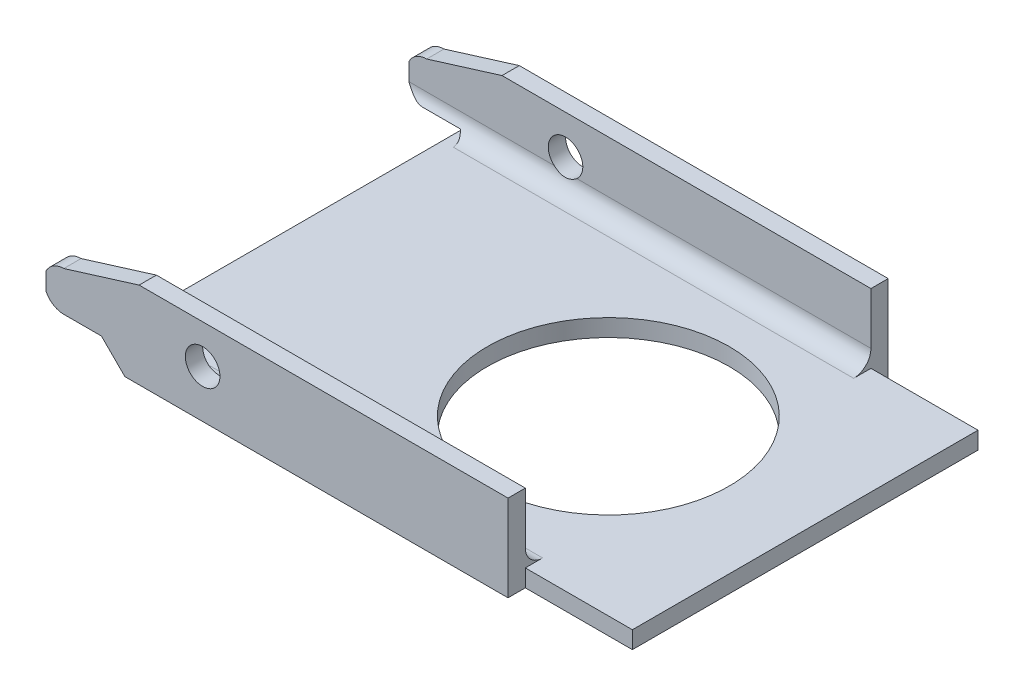
from build123d import *

# Parameters (mm, degrees)
SKETCH1_W               = 76.2
SKETCH1_H               = 50.8
BOSS_EXTRUDE1_DEPTH     = 2.54
BOSS_EXTRUDE3_DEPTH     = 2.54
FILLET1_START           = -37.396373698
FILLET1_DEPTH           = 59.758551136
FILLET1_START_2         = -45.547043779
FILLET1_2_DEPTH         = 8.279361144
FILLET1_START_3         = 22
FILLET1_3_DEPTH         = 3.4
FILLET2_START           = -42.930825639
FILLET2_DEPTH           = 65.293003077
FILLET2_START_2         = -37.396373698
FILLET2_2_DEPTH         = 59.758551136
FILLET2_START_3         = -45.547043779
FILLET2_3_DEPTH         = 2.61621814
FILLET2_START_4         = -25.4
FILLET2_4_DEPTH         = 3.4
CUT_EXTRUDE1_DEPTH      = 74.201076537
CUT_EXTRUDE1_DEPTH_BACK = 74.201076537
SKETCH3_R               = 2.54
CUT_EXTRUDE2_DEPTH      = 55.391197925
CUT_EXTRUDE2_DEPTH_BACK = 55.391197925
SKETCH4_R               = 17.770620532


with BuildPart() as part:
    # Sketch1 → Boss-Extrude1 (new body)
    with BuildSketch(Plane(origin=(0, 0, 0), x_dir=(1, 0, 0), z_dir=(0, 1, 0))):
        Rectangle(SKETCH1_W, SKETCH1_H)
    extrude(amount=BOSS_EXTRUDE1_DEPTH)

    # Sketch2 → Boss-Extrude3 (add)
    with BuildSketch(Plane.XY.offset(25.4)):
        Polygon((22.362177438, 0), (22.362177438, 2.54), (-36.496143753, 2.54), (-33.956143753, 0), align=None)
        with BuildLine():
            Line((22.362177438, 12.7), (-31.861921757, 12.7))
            Line((-31.861921757, 12.7), (-42.930825639, 9.27384145))
            ThreePointArc((-42.930825639, 9.27384145), (-44.471302904, 8.833865445), (-45.547043679, 7.646670905))
            Line((-45.547043679, 7.646670905), (-45.547043679, 5.06740049))
            ThreePointArc((-45.547043679, 5.06740049), (-44.471302904, 3.88020595), (-42.930825639, 3.440229945))
            Line((-42.930825639, 3.440229945), (-37.396373698, 3.440229945))
            Line((-37.396373698, 3.440229945), (-36.496143753, 2.54))
            Line((-36.496143753, 2.54), (22.362177438, 2.54))
            Line((22.362177438, 2.54), (22.362177438, 12.7))
        make_face()
    boss_extrude3 = extrude(amount=BOSS_EXTRUDE3_DEPTH)

    # Fillet1: read off the stored shape, not the designer's step
    # Fillet1 outline → Fillet1 (add)
    with BuildSketch(Plane.YZ.offset(FILLET1_START)):
        with BuildLine():
            ThreePointArc((2.54, 22.86), (3.283948776, 24.656051224), (5.08, 25.4))
            Line((5.08, 25.4), (2.54, 25.4))
            Line((2.54, 25.4), (2.54, 22.86))
        make_face()
    extrude(amount=FILLET1_DEPTH)

    # Fillet1 2 outline → Fillet1 2 (add)
    with BuildSketch(Plane.YZ.offset(FILLET1_START_2)):
        with BuildLine():
            Line((3.440229945, 25.4), (3.440229945, 24.799781989))
            ThreePointArc((3.440229945, 24.799781989), (4.206915311, 25.245230204), (5.08, 25.4))
            Line((5.08, 25.4), (3.440229945, 25.4))
        make_face()
    extrude(amount=FILLET1_2_DEPTH)

    # Fillet1 3 outline → Fillet1 3 (cut)
    with BuildSketch(Plane.XY.offset(FILLET1_START_3)):
        with BuildLine():
            Line((-45.547043779, 3.440229945), (-42.930825639, 3.440229945))
            ThreePointArc((-42.930825639, 3.440229945), (-44.471302904, 3.88020595), (-45.547043679, 5.06740049))
            Line((-45.547043679, 5.06740049), (-45.547043779, 3.440229945))
        make_face()
        Polygon((-36.496143753, 2.54), (-37.396373698, 3.440229945), (-37.396373698, 2.54), align=None)
    extrude(amount=FILLET1_3_DEPTH, mode=Mode.SUBTRACT)

    # Mirror1: Boss-Extrude3 across plane
    add(boss_extrude3.mirror(Plane.XY))

    # Fillet2: read off the stored shape, not the designer's step
    # Fillet2 outline → Fillet2 (add)
    with BuildSketch(Plane.YZ.offset(FILLET2_START)):
        with BuildLine():
            ThreePointArc((5.08, -25.4), (4.206915311, -25.245230204), (3.440229945, -24.799781989))
            Line((3.440229945, -24.799781989), (3.440229945, -25.4))
            Line((3.440229945, -25.4), (5.08, -25.4))
        make_face()
    extrude(amount=FILLET2_DEPTH)

    # Fillet2 2 outline → Fillet2 2 (add)
    with BuildSketch(Plane.YZ.offset(FILLET2_START_2)):
        with BuildLine():
            ThreePointArc((3.440229945, -24.799781989), (2.776023444, -23.929248348), (2.54, -22.86))
            Line((2.54, -22.86), (2.54, -25.4))
            Line((2.54, -25.4), (3.440229945, -25.4))
            Line((3.440229945, -25.4), (3.440229945, -24.799781989))
        make_face()
    extrude(amount=FILLET2_2_DEPTH)

    # Fillet2 3 outline → Fillet2 3 (add)
    with BuildSketch(Plane.YZ.offset(FILLET2_START_3)):
        with BuildLine():
            ThreePointArc((5.08, -25.4), (4.206915311, -25.245230204), (3.440229945, -24.799781989))
            Line((3.440229945, -24.799781989), (3.440229945, -25.4))
            Line((3.440229945, -25.4), (5.08, -25.4))
        make_face()
    extrude(amount=FILLET2_3_DEPTH)

    # Fillet2 4 outline → Fillet2 4 (cut)
    with BuildSketch(Plane.XY.offset(FILLET2_START_4)):
        Polygon((-36.496143753, 2.54), (-37.396373698, 3.440229945), (-37.396373698, 2.54), align=None)
        with BuildLine():
            ThreePointArc((-42.930825639, 3.440229945), (-44.471302904, 3.88020595), (-45.547043679, 5.06740049))
            Line((-45.547043679, 5.06740049), (-45.547043779, 3.440229945))
            Line((-45.547043779, 3.440229945), (-42.930825639, 3.440229945))
        make_face()
    extrude(amount=FILLET2_4_DEPTH, mode=Mode.SUBTRACT)

    # Sketch3 → Cut-Extrude1 (cut, two sides: drawn at the far end of the back side and taken through both)
    with BuildSketch(Plane.XY.offset(27.94).offset(-CUT_EXTRUDE1_DEPTH_BACK)):
        with Locations((-22.524221352, 7.006792996)):
            Circle(SKETCH3_R)
    extrude(amount=CUT_EXTRUDE1_DEPTH + CUT_EXTRUDE1_DEPTH_BACK, mode=Mode.SUBTRACT)

    # Sketch4 → Cut-Extrude2 (cut, two sides: drawn at the far end of the back side and taken through both)
    with BuildSketch(Plane(origin=(0, 2.54, 0), x_dir=(1, 0, 0), z_dir=(0, 1, 0)).offset(-CUT_EXTRUDE2_DEPTH_BACK)):
        with Locations(Location((9.166040708, 0, 0), (0, 0, 270))):
            Circle(SKETCH4_R)
    extrude(amount=CUT_EXTRUDE2_DEPTH + CUT_EXTRUDE2_DEPTH_BACK, mode=Mode.SUBTRACT)


solid = part.part
